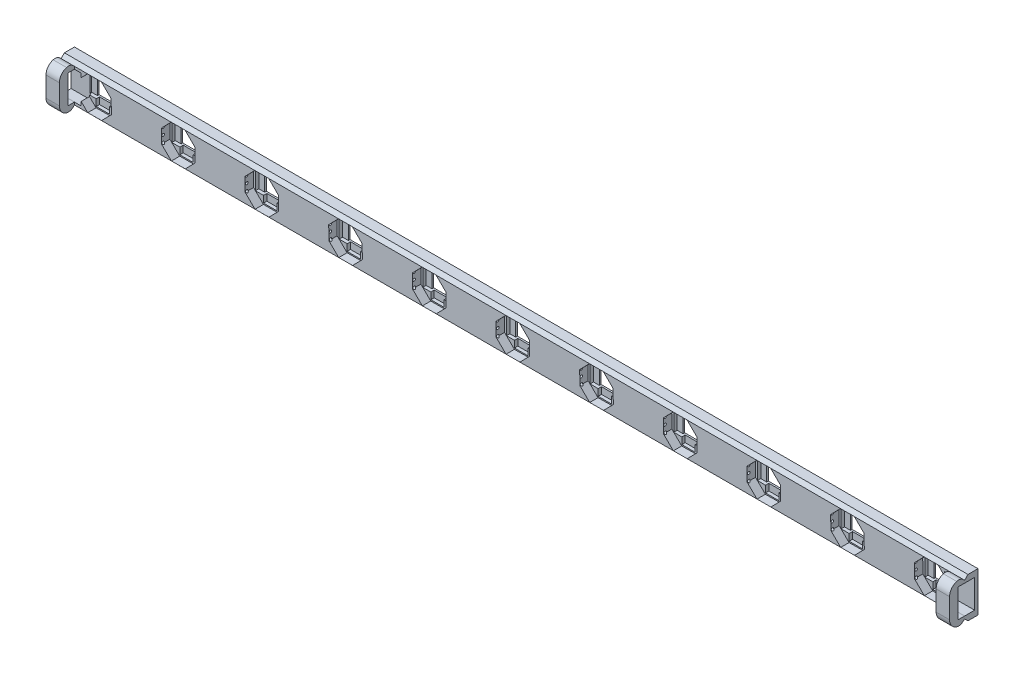
from build123d import *

# Parameters (mm, degrees)
SKETCH1_W                = 270
SKETCH1_H                = 12
BOSS_EXTRUDE1_DEPTH      = 4
CUT_EXTRUDE1_DEPTH       = 2.5
SKETCH4_W                = 5.3
SKETCH4_H                = 5.3
CUT_EXTRUDE2_DEPTH       = 280.80470486
SKETCH6_W                = 4
SKETCH6_H                = 2
CUT_EXTRUDE3_DEPTH       = 1
SKETCH7_W                = 4
SKETCH7_H                = 2
CUT_EXTRUDE4_DEPTH       = 1
SKETCH10_W               = 1.75
SKETCH10_H               = 5.333464967
SKETCH10_H_2             = 5.3
CUT_EXTRUDE7_DEPTH       = 1
CUT_EXTRUDE8_DEPTH       = 271.127291221
CUT_EXTRUDE8_DEPTH_BACK  = 271.127291221
SKETCH11_R               = 0.375
CUT_EXTRUDE9_DEPTH       = 271.127291221
CUT_EXTRUDE9_DEPTH_BACK  = 271.127291221
SKETCH12_R               = 0.375
CUT_EXTRUDE10_DEPTH      = 271.127291221
CUT_EXTRUDE10_DEPTH_BACK = 271.127291221
SKETCH13_R               = 0.375
CUT_EXTRUDE11_DEPTH      = 280.822127184
CUT_EXTRUDE11_DEPTH_BACK = 3
SKETCH14_W               = 6
SKETCH14_H               = 8.5
SKETCH15_W               = 4
SKETCH15_H               = 12
BOSS_EXTRUDE2_DEPTH      = 4.5
SKETCH16_W               = 2
SKETCH16_H               = 8.500297862
CUT_EXTRUDE12_DEPTH      = 4.5
FILLET1_R                = 3
FILLET2_R                = 3
SKETCH17_W               = 6
SKETCH17_H               = 8.5
CUT_EXTRUDE13_DEPTH      = 3
SKETCH18_W               = 4
SKETCH18_H               = 12
BOSS_EXTRUDE3_DEPTH      = 4.5
SKETCH19_W               = 2
SKETCH19_H               = 8.49933276
CUT_EXTRUDE14_DEPTH      = 4.5
FILLET3_R                = 3
FILLET4_R                = 3
CHAMFER1_SIZE            = 1
CHAMFER2_SIZE            = 1
CUT_EXTRUDE15_DEPTH      = 267.234865227
CUT_EXTRUDE15_DEPTH_BACK = 267.234865227
CUT_EXTRUDE16_DEPTH      = 267.234865227
CUT_EXTRUDE16_DEPTH_BACK = 267.234865227
CHAMFER3_SIZE            = 1
CHAMFER4_SIZE            = 1
CHAMFER5_SIZE            = 1
CHAMFER6_SIZE            = 1
FILLET5_R                = 2
FILLET6_R                = 2
FILLET7_R                = 2
FILLET8_R                = 2
LPATTERN1_COUNT          = 11
LPATTERN1_PITCH          = 25


# Some blends are built 0.0001 mm under size
with BuildPart() as part:
    # Sketch1 → Boss-Extrude1 (new body)
    with BuildSketch(Plane.XY):
        with Locations((-144.69924812, 1.263157895)):
            Rectangle(SKETCH1_W, SKETCH1_H)
    extrude(amount=BOSS_EXTRUDE1_DEPTH)

    # Sketch3 → Cut-Extrude1 (cut)
    with BuildSketch(Plane.XY.offset(4)):
        Polygon((-17.589220634, -3.720526073), (-14.683236648, -0.76882409), (-14.715564153, 3.373185381), (-17.667266136, 6.279169368), (-21.809275607, 6.246841862), (-24.715259593, 3.295139879), (-24.682932088, -0.846869592), (-21.731230105, -3.752853578), align=None)
    cut_extrude1 = extrude(amount=-CUT_EXTRUDE1_DEPTH, mode=Mode.SUBTRACT)

    # Sketch4 → Cut-Extrude2 (cut, through all)
    with BuildSketch(Plane.XY.offset(1.5)):
        with Locations((-19.69924812, 1.263157895)):
            Rectangle(SKETCH4_W, SKETCH4_H)
    cut_extrude2 = extrude(amount=-CUT_EXTRUDE2_DEPTH, mode=Mode.SUBTRACT)

    # Sketch6 → Cut-Extrude3 (cut)
    with BuildSketch(Plane.XY.offset(1.5)):
        with Locations((-19.69924812, -2.386842105)):
            Rectangle(SKETCH6_W, SKETCH6_H)
    cut_extrude3 = extrude(amount=-CUT_EXTRUDE3_DEPTH, mode=Mode.SUBTRACT)

    # Sketch7 → Cut-Extrude4 (cut)
    with BuildSketch(Plane.XY.offset(1.5)):
        with Locations((-19.69924812, 4.913157895)):
            Rectangle(SKETCH7_W, SKETCH7_H)
    cut_extrude4 = extrude(amount=-CUT_EXTRUDE4_DEPTH, mode=Mode.SUBTRACT)

    # Sketch10 → Cut-Extrude7 (cut)
    with BuildSketch(Plane.XY.offset(1.5)):
        with Locations((-16.17424812, 1.246425412)):
            Rectangle(SKETCH10_W, SKETCH10_H)
        with Locations((-23.22424812, 1.263157895)):
            Rectangle(SKETCH10_W, SKETCH10_H_2)
    cut_extrude7 = extrude(amount=-CUT_EXTRUDE7_DEPTH, mode=Mode.SUBTRACT)

    # Sketch11 → Cut-Extrude8 (cut, two sides: drawn at the far end of the back side and taken through both)
    with BuildSketch(Plane(origin=(-9.69924812, 0, 0), x_dir=(0, 0, -1), z_dir=(1, 0, 0)).offset(-CUT_EXTRUDE8_DEPTH_BACK)):
        with Locations(Location((-3.5, 1.263157895, 0), (0, 0, 270))):
            Circle(SKETCH11_R)
    extrude(amount=CUT_EXTRUDE8_DEPTH + CUT_EXTRUDE8_DEPTH_BACK, mode=Mode.SUBTRACT)

    # Sketch12 → Cut-Extrude9 (cut, two sides: drawn at the far end of the back side and taken through both)
    with BuildSketch(Plane(origin=(-9.69924812, 0, 0), x_dir=(0, 0, -1), z_dir=(1, 0, 0)).offset(-CUT_EXTRUDE9_DEPTH_BACK)):
        with Locations(Location((-3.5, -0.736842105, 0), (0, 0, 355.107569496))):
            Circle(SKETCH12_R)
    extrude(amount=CUT_EXTRUDE9_DEPTH + CUT_EXTRUDE9_DEPTH_BACK, mode=Mode.SUBTRACT)

    # Sketch13 → Cut-Extrude10 (cut, two sides: drawn at the far end of the back side and taken through both)
    with BuildSketch(Plane(origin=(-9.69924812, 0, 0), x_dir=(0, 0, -1), z_dir=(1, 0, 0)).offset(-CUT_EXTRUDE10_DEPTH_BACK)):
        with Locations(Location((-3.5, 3.263157895, 0), (0, 0, 17.062016504))):
            Circle(SKETCH13_R)
    extrude(amount=CUT_EXTRUDE10_DEPTH + CUT_EXTRUDE10_DEPTH_BACK, mode=Mode.SUBTRACT)

    # Sketch14 → Cut-Extrude11 (cut, two sides: drawn at the far end of the back side and taken through both)
    with BuildSketch(Plane.XY.offset(4).offset(-CUT_EXTRUDE11_DEPTH_BACK)):
        with Locations((-12.69924812, 1.263157895)):
            Rectangle(SKETCH14_W, SKETCH14_H)
    extrude(amount=CUT_EXTRUDE11_DEPTH + CUT_EXTRUDE11_DEPTH_BACK, mode=Mode.SUBTRACT)

    # Sketch15 → Boss-Extrude2 (add)
    with BuildSketch(Plane.XY.offset(4)):
        with Locations((-11.69924812, 1.263157895)):
            Rectangle(SKETCH15_W, SKETCH15_H)
    extrude(amount=BOSS_EXTRUDE2_DEPTH)

    # Sketch16 → Cut-Extrude12 (cut)
    with BuildSketch(Plane(origin=(-9.69924812, 0, 0), x_dir=(0, 0, -1), z_dir=(1, 0, 0))):
        with Locations((-5, 1.263008964)):
            Rectangle(SKETCH16_W, SKETCH16_H)
    extrude(amount=-CUT_EXTRUDE12_DEPTH, mode=Mode.SUBTRACT)

    # Fillet1
    fillet1_edges = [part.edges().sort_by_distance(p)[0] for p in [
        (-11.69924812, 7.263157895, 8.5),
    ]]
    fillet(fillet1_edges, radius=FILLET1_R)

    # Fillet2
    fillet2_edges = [part.edges().sort_by_distance(p)[0] for p in [
        (-11.69924812, -4.736842105, 8.5),
    ]]
    fillet(fillet2_edges, radius=FILLET2_R)

    # Sketch17 → Cut-Extrude13 (cut)
    with BuildSketch(Plane.XY.offset(4)):
        with Locations((-276.69924812, 1.263157895)):
            Rectangle(SKETCH17_W, SKETCH17_H)
    extrude(amount=-CUT_EXTRUDE13_DEPTH, mode=Mode.SUBTRACT)

    # Sketch18 → Boss-Extrude3 (add)
    with BuildSketch(Plane.XY.offset(4)):
        with Locations((-277.69924812, 1.263157895)):
            Rectangle(SKETCH18_W, SKETCH18_H)
    extrude(amount=BOSS_EXTRUDE3_DEPTH)

    # Sketch19 → Cut-Extrude14 (cut)
    with BuildSketch(Plane.ZY.offset(279.69924812)):
        with Locations((5, 1.263491515)):
            Rectangle(SKETCH19_W, SKETCH19_H)
    extrude(amount=-CUT_EXTRUDE14_DEPTH, mode=Mode.SUBTRACT)

    # Fillet3
    fillet3_edges = [part.edges().sort_by_distance(p)[0] for p in [
        (-277.69924812, 7.263157895, 8.5),
    ]]
    fillet(fillet3_edges, radius=FILLET3_R)

    # Fillet4
    fillet4_edges = [part.edges().sort_by_distance(p)[0] for p in [
        (-277.69924812, -4.736842105, 8.5),
    ]]
    fillet(fillet4_edges, radius=FILLET4_R)

    # Chamfer1
    # the kernel refuses this chamfer: 1 mm, written as the material it takes off along each edge
    with BuildSketch(Plane(origin=(-275.69924812, 7.263157895, 4), x_dir=(0, 0.027495876610586487, -0.9996219169112968), z_dir=(1, 0, 0))) as chamfer1_piece_1:
        Polygon((CHAMFER1_SIZE * 0.999621916911, -CHAMFER1_SIZE * 0.0274958766106), (-CHAMFER1_SIZE * 0.0274958766106, -CHAMFER1_SIZE * 0.999621916911), (0, 0), align=None)
    extrude(amount=262, mode=Mode.SUBTRACT)

    # Chamfer2
    # the kernel refuses this chamfer: 1 mm, written as the material it takes off along each edge
    with BuildSketch(Plane(origin=(-13.69924812, -4.736842105, 4), x_dir=(0, 0.9996219169112968, 0.027495876610586487), z_dir=(-1, 0, 0))) as chamfer2_piece_1:
        Polygon((CHAMFER2_SIZE * 0.999621916911, CHAMFER2_SIZE * 0.0274958766106), (-CHAMFER2_SIZE * 0.0274958766106, CHAMFER2_SIZE * 0.999621916911), (0, 0), align=None)
    extrude(amount=262, mode=Mode.SUBTRACT)

    # Sketch30 → Cut-Extrude15 (cut, two sides: drawn at the far end of the back side and taken through both)
    with BuildSketch(Plane(origin=(-275.69924812, 0, 0), x_dir=(0, 0, -1), z_dir=(1, 0, 0)).offset(-CUT_EXTRUDE15_DEPTH_BACK)):
        Polygon((-3, -4.736842105), (-4, -3.736842105), (-4, -4.736842105), align=None)
    extrude(amount=CUT_EXTRUDE15_DEPTH + CUT_EXTRUDE15_DEPTH_BACK, mode=Mode.SUBTRACT)

    # Sketch31 → Cut-Extrude16 (cut, two sides: drawn at the far end of the back side and taken through both)
    with BuildSketch(Plane(origin=(-275.69924812, 0, 0), x_dir=(0, 0, -1), z_dir=(1, 0, 0)).offset(-CUT_EXTRUDE16_DEPTH_BACK)):
        Polygon((-4, 6.263157895), (-3, 7.263157895), (-4, 7.263157895), align=None)
    extrude(amount=CUT_EXTRUDE16_DEPTH + CUT_EXTRUDE16_DEPTH_BACK, mode=Mode.SUBTRACT)

    # Chamfer3
    chamfer3_edges = [part.edges().sort_by_distance(p)[0] for p in [
        (-277.69924812, 7.263157895, 4),
    ]]
    chamfer(chamfer3_edges, length=CHAMFER3_SIZE - 0.0001)  # a hair under: the kernel refuses the full size

    # Chamfer4
    chamfer4_edges = [part.edges().sort_by_distance(p)[0] for p in [
        (-11.69924812, 7.263157895, 4),
    ]]
    chamfer(chamfer4_edges, length=CHAMFER4_SIZE - 0.0001)  # a hair under: the kernel refuses the full size

    # Chamfer5
    chamfer5_edges = [part.edges().sort_by_distance(p)[0] for p in [
        (-11.69924812, -4.736842105, 4),
    ]]
    chamfer(chamfer5_edges, length=CHAMFER5_SIZE - 0.0001)  # a hair under: the kernel refuses the full size

    # Chamfer6
    chamfer6_edges = [part.edges().sort_by_distance(p)[0] for p in [
        (-277.69924812, -4.736842105, 4),
    ]]
    chamfer(chamfer6_edges, length=CHAMFER6_SIZE - 0.0001)  # a hair under: the kernel refuses the full size

    # Fillet5
    fillet5_edges = [part.edges().sort_by_distance(p)[0] for p in [
        (-11.69924812, 7.263157895, 4.9999),
    ]]
    fillet(fillet5_edges, radius=FILLET5_R)

    # Fillet6
    fillet6_edges = [part.edges().sort_by_distance(p)[0] for p in [
        (-11.69924812, -4.736842105, 4.9999),
    ]]
    fillet(fillet6_edges, radius=FILLET6_R)

    # Fillet7
    fillet7_edges = [part.edges().sort_by_distance(p)[0] for p in [
        (-277.69924812, -4.736842105, 4.9999),
    ]]
    fillet(fillet7_edges, radius=FILLET7_R)

    # Fillet8
    fillet8_edges = [part.edges().sort_by_distance(p)[0] for p in [
        (-277.69924812, 7.263157895, 4.9999),
    ]]
    fillet(fillet8_edges, radius=FILLET8_R)

    # LPattern1: Cut-Extrude1, Cut-Extrude2, Cut-Extrude3, Cut-Extrude4, Cut-Extrude7 ×11
    with Locations(*[(-i * LPATTERN1_PITCH, 0, 0) for i in range(1, LPATTERN1_COUNT)]):
        add(cut_extrude1, mode=Mode.SUBTRACT)
        add(cut_extrude2, mode=Mode.SUBTRACT)
        add(cut_extrude3, mode=Mode.SUBTRACT)
        add(cut_extrude4, mode=Mode.SUBTRACT)
        add(cut_extrude7, mode=Mode.SUBTRACT)


solid = part.part
